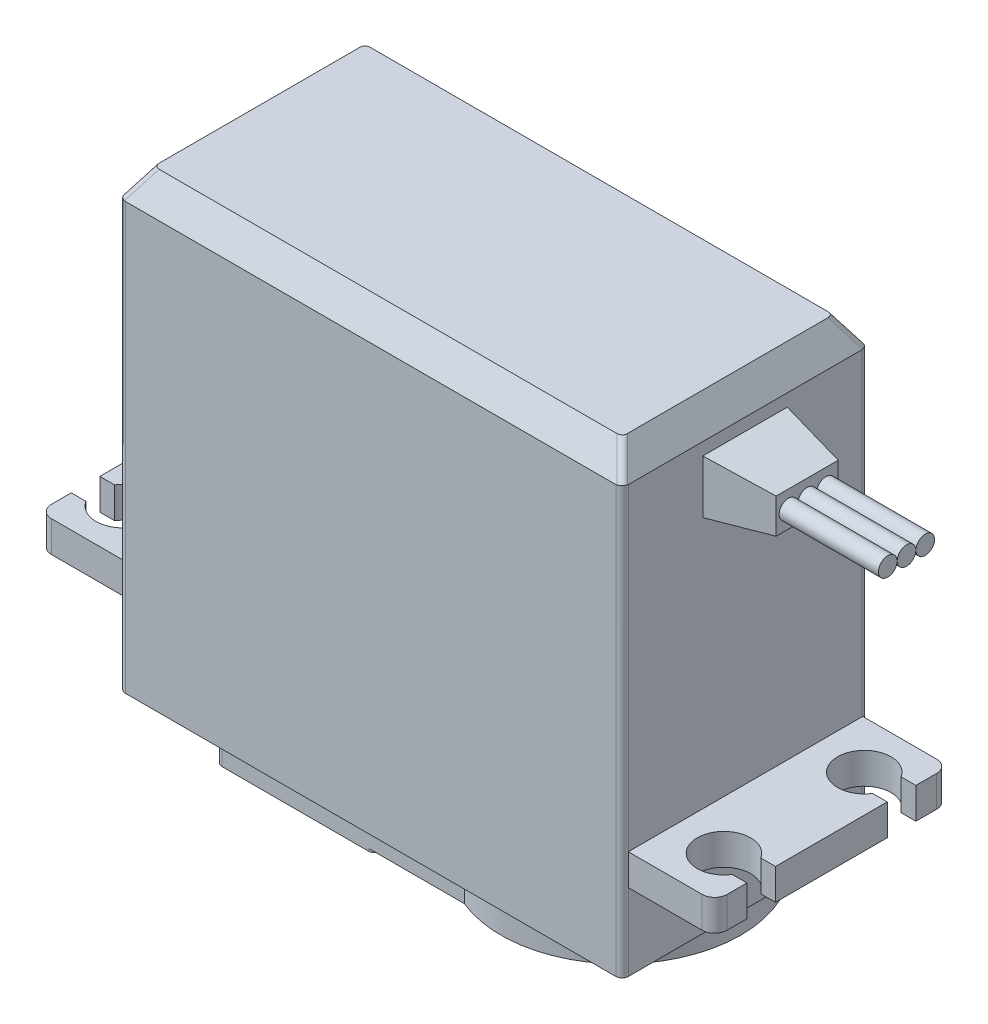
from build123d import *
from OCP.BRepFilletAPI import BRepFilletAPI_MakeChamfer

# Parameters (mm, degrees)
SKETCH_1_W       = 40.5
SKETCH_1_H       = 19.8
BODY_DEPTH       = 36.5
CHAMFER_1_SIZE   = 2.2
CHAMFER_1_SIZE2  = 1.4
FILLET_1_R       = 0.5
MOUNT_DEPTH      = 2.5
EXTRUDE_3_DEPTH  = 0.5
EXTRUDE_4_DEPTH  = 2
SKETCH_5_W       = 10.8
SKETCH_5_H       = 15.84
EXTRUDE_5_DEPTH  = 0.2
SKETCH_6_R       = 6.6
EXTRUDE_6_DEPTH  = 1.2
SKETCH_7_R       = 5.35
EXTRUDE_7_DEPTH  = 0.5
SKETCH_8_R       = 2.6
SHAFT_HOLE_DEPTH = 10
FILLET_2_R       = 0.5
SKETCH_11_R      = 0.75
EXTRUDE_10_DEPTH = 8


with BuildPart() as part:
    # Эскиз1 → Body (new body)
    with BuildSketch(Plane(origin=(0, 0, 0), x_dir=(1, 0, 0), z_dir=(0, 1, 0))):
        Rectangle(SKETCH_1_W, SKETCH_1_H)
    extrude(amount=BODY_DEPTH)

    # Фаска1: one chamfer whose edges measure the first distance from different faces: ONE call of the kernel's chamfer builder (chamfer() names one face for all edges)
    chamfer_1_edges_1 = [part.edges().sort_by_distance(p)[0] for p in [
        (20.25, 36.5, 0),
    ]]
    chamfer_1_side_1 = [part.faces().sort_by_distance(p)[0] for p in [
        (20.25, 18.25, 0),
    ]]
    chamfer_1_edges_2 = [part.edges().sort_by_distance(p)[0] for p in [
        (0, 36.5, -9.9),
    ]]
    chamfer_1_side_2 = [part.faces().sort_by_distance(p)[0] for p in [
        (0, 18.25, -9.9),
    ]]
    chamfer_1_edges_3 = [part.edges().sort_by_distance(p)[0] for p in [
        (-20.25, 36.5, 0),
    ]]
    chamfer_1_side_3 = [part.faces().sort_by_distance(p)[0] for p in [
        (-20.25, 18.25, 0),
    ]]
    chamfer_1_edges_4 = [part.edges().sort_by_distance(p)[0] for p in [
        (0, 36.5, 9.9),
    ]]
    chamfer_1_side_4 = [part.faces().sort_by_distance(p)[0] for p in [
        (0, 18.25, 9.9),
    ]]
    chamfer_1 = BRepFilletAPI_MakeChamfer(part.part.solid().wrapped)
    for e in chamfer_1_edges_1:
        chamfer_1.Add(CHAMFER_1_SIZE, CHAMFER_1_SIZE2, e.wrapped, chamfer_1_side_1[0].wrapped)  # the first distance lies on this face
    for e in chamfer_1_edges_2:
        chamfer_1.Add(CHAMFER_1_SIZE, CHAMFER_1_SIZE2, e.wrapped, chamfer_1_side_2[0].wrapped)  # the first distance lies on this face
    for e in chamfer_1_edges_3:
        chamfer_1.Add(CHAMFER_1_SIZE, CHAMFER_1_SIZE2, e.wrapped, chamfer_1_side_3[0].wrapped)  # the first distance lies on this face
    for e in chamfer_1_edges_4:
        chamfer_1.Add(CHAMFER_1_SIZE, CHAMFER_1_SIZE2, e.wrapped, chamfer_1_side_4[0].wrapped)  # the first distance lies on this face
    add(Compound.cast(chamfer_1.Shape()), mode=Mode.REPLACE)

    # Скругление1
    # the kernel refuses this fillet: 0.5 mm, written as the material it takes off along each edge
    with BuildSketch(Plane(origin=(-20.25, -1.25, 9.9), x_dir=(1, 0, 0), z_dir=(0, 1, 0)), Plane(origin=(-20.25, -1.25, -9.9), x_dir=(0, 0, 1), z_dir=(0, 1, 0))) as fillet_1_piece_1:
        with BuildLine():
            CenterArc((FILLET_1_R, FILLET_1_R), FILLET_1_R, 180, 90)
            Line((0, FILLET_1_R), (0, 0))
            Line((0, 0), (FILLET_1_R, 0))
        make_face()
    extrude(amount=36.8, mode=Mode.SUBTRACT)
    with BuildSketch(Plane(origin=(20.25, -1.25, -9.9), x_dir=(0, 0, 1), z_dir=(0, 1, 0)), Plane(origin=(20.25, -1.25, 9.9), x_dir=(-1, 0, 0), z_dir=(0, 1, 0))) as fillet_1_piece_2:
        with BuildLine():
            CenterArc((FILLET_1_R, -FILLET_1_R), FILLET_1_R, 90, 90)
            Line((0, -FILLET_1_R), (0, 0))
            Line((0, 0), (FILLET_1_R, 0))
        make_face()
    extrude(amount=36.8, mode=Mode.SUBTRACT)
    with BuildSketch(Plane(origin=(20.689497717, 33.609360731, -10.339497717), x_dir=(0.25395078633508533, -0.3990655213836877, 0.8810537485094523), z_dir=(-0.47301616487963943, 0.7433111162394352, 0.47301616487964004)), Plane(origin=(20.689497717, 33.609360731, 10.339497717), x_dir=(-0.8810537485094526, -0.39906552138369156, 0.25395078633507817), z_dir=(-0.47301616487963943, 0.7433111162394352, -0.47301616487964004))) as fillet_1_piece_3:
        with BuildLine():
            CenterArc((FILLET_1_R * 0.743311116239, -FILLET_1_R), FILLET_1_R, 90, 73.247664886)
            Line((-FILLET_1_R * 0.21424849821, -FILLET_1_R * 0.711764705882), (0, 0))
            Line((0, 0), (FILLET_1_R * 0.743311116239, 0))
        make_face()
    extrude(amount=4.818007508, mode=Mode.SUBTRACT)
    with BuildSketch(Plane(origin=(-20.689497717, 33.609360731, -10.339497717), x_dir=(-0.25395078633507856, -0.3990655213836921, 0.8810537485094524), z_dir=(0.47301616487963943, 0.7433111162394352, 0.47301616487964004)), Plane(origin=(-20.689497717, 33.609360731, 10.339497717), x_dir=(0.8810537485094527, -0.3990655213836916, 0.25395078633507817), z_dir=(0.47301616487963943, 0.7433111162394352, -0.47301616487964004))) as fillet_1_piece_4:
        with BuildLine():
            CenterArc((FILLET_1_R * 0.743311116239, FILLET_1_R), FILLET_1_R, 196.752335114, 73.247664886)
            Line((-FILLET_1_R * 0.21424849821, FILLET_1_R * 0.711764705882), (0, 0))
            Line((0, 0), (FILLET_1_R * 0.743311116239, 0))
        make_face()
    extrude(amount=4.818007508, mode=Mode.SUBTRACT)

    # Эскиз2 → Mount (add)
    with BuildSketch(Plane(origin=(0, 6.2, 0), x_dir=(-1, 0, 0), z_dir=(0, -1, 0))):
        with BuildLine():
            Line((-26.2, 9.472835762), (26.2, 9.472835762))
            ThreePointArc((26.2, 9.472835762), (26.907106781, 9.179942543), (27.2, 8.472835762))
            Line((27.2, 8.472835762), (27.2, 6.8))
            Line((27.2, 6.8), (26.016590212, 6.8))
            ThreePointArc((26.016590212, 6.8), (22.05, 5.65), (26.016590212, 4.5))
            Line((26.016590212, 4.5), (27.2, 4.5))
            Line((27.2, 4.5), (27.2, -4.5))
            Line((27.2, -4.5), (26.016590212, -4.5))
            ThreePointArc((26.016590212, -4.5), (22.05, -5.65), (26.016590212, -6.8))
            Line((26.016590212, -6.8), (27.2, -6.8))
            Line((27.2, -6.8), (27.2, -8.4))
            ThreePointArc((27.2, -8.4), (26.907106781, -9.107106781), (26.2, -9.4))
            Line((26.2, -9.4), (-26.2, -9.4))
            ThreePointArc((-26.2, -9.4), (-26.907106781, -9.107106781), (-27.2, -8.4))
            Line((-27.2, -8.4), (-27.2, -6.8))
            Line((-27.2, -6.8), (-26.016590212, -6.8))
            ThreePointArc((-26.016590212, -6.8), (-22.05, -5.65), (-26.016590212, -4.5))
            Line((-26.016590212, -4.5), (-27.2, -4.5))
            Line((-27.2, -4.5), (-27.2, 4.5))
            Line((-27.2, 4.5), (-26.016590212, 4.5))
            ThreePointArc((-26.016590212, 4.5), (-22.05, 5.65), (-26.016590212, 6.8))
            Line((-26.016590212, 6.8), (-27.2, 6.8))
            Line((-27.2, 6.8), (-27.2, 8.472835762))
            ThreePointArc((-27.2, 8.472835762), (-26.907106781, 9.179942543), (-26.2, 9.472835762))
        make_face()
    extrude(amount=-MOUNT_DEPTH)

    # Эскиз3 → Бобышка-Вытянуть3 (add, symmetric)
    with BuildSketch(Plane.XY):
        Polygon((-27.2, 6.2), (-20.25, 6.2), (-20.25, 5.2), align=None)
        Polygon((20.25, 5.2), (27.2, 6.2), (20.25, 6.2), align=None)
    extrude(amount=EXTRUDE_3_DEPTH, both=True)

    # Эскиз4 → Бобышка-Вытянуть4 (add)
    with BuildSketch(Plane.XZ):
        with BuildLine():
            Line((-13.452560024, -8.92), (-13.452560024, -4.6))
            ThreePointArc((-13.452560024, -4.6), (-16.49296823, 0), (-13.452560024, 4.6))
            Line((-13.452560024, 4.6), (-13.452560024, 8.92))
            Line((-13.452560024, 8.92), (6.568139057, 8.92))
            ThreePointArc((6.568139057, 8.92), (19.9, 0), (6.568139057, -8.92))
            Line((6.568139057, -8.92), (-13.452560024, -8.92))
        make_face()
    extrude(amount=EXTRUDE_4_DEPTH)

    # Эскиз5 → Бобышка-Вытянуть5 (add)
    with BuildSketch(Plane.XZ.offset(2)):
        with BuildLine():
            Line((-13.452560024, 8.92), (-0.652560024, 8.92))
            Line((-0.652560024, 8.92), (-0.652560024, 2))
            ThreePointArc((-0.652560024, 2), (1.347439976, 0), (-0.652560024, -2))
            Line((-0.652560024, -2), (-0.652560024, -8.92))
            Line((-0.652560024, -8.92), (-13.452560024, -8.92))
            Line((-13.452560024, -8.92), (-13.452560024, 8.92))
        make_face()
        with Locations((-7.052560024, 0)):
            Rectangle(SKETCH_5_W, SKETCH_5_H, mode=Mode.SUBTRACT)
    extrude(amount=EXTRUDE_5_DEPTH)

    # Эскиз6 → Бобышка-Вытянуть6 (add)
    with BuildSketch(Plane.XZ.offset(2)):
        with Locations(Location((10.25, 0, 0), (0, 0, 270))):
            Circle(SKETCH_6_R)
    extrude(amount=EXTRUDE_6_DEPTH)

    # Эскиз7 → Бобышка-Вытянуть7 (add)
    with BuildSketch(Plane.XZ.offset(3.2)):
        with Locations(Location((10.25, 0, 0), (0, 0, 270))):
            Circle(SKETCH_7_R)
    extrude(amount=EXTRUDE_7_DEPTH)

    # Эскиз8 → Shaft hole (cut)
    with BuildSketch(Plane.XZ.offset(3.7)):
        with Locations(Location((10.25, 0, 0), (0, 0, 270))):
            Circle(SKETCH_8_R)
    extrude(amount=-SHAFT_HOLE_DEPTH, mode=Mode.SUBTRACT)

    # Скругление2
    fillet_2_edges = [part.edges().sort_by_distance(p)[0] for p in [
        (-13.452560024, -1.1, 8.92),
        (-0.652560024, -2.1, 2),
        (-0.652560024, -2.1, -2),
        (-0.652560024, -2.1, 8.92),
        (-0.652560024, -2.1, -8.92),
        (-13.452560024, -1.1, -8.92),
        (-1.652560024, -2.1, 7.92),
        (-1.652560024, -2.1, -7.92),
        (-12.452560024, -2.1, 7.92),
        (-12.452560024, -2.1, -7.92),
    ]]
    fillet(fillet_2_edges, radius=FILLET_2_R)

    # Эскиз10 → Rubber section 0
    with BuildSketch(Plane(origin=(25.25, 0, 0), x_dir=(0, 0, -1), z_dir=(1, 0, 0))):
        with BuildLine():
            Line((-2.5, 29.75), (2.5, 29.75))
            Line((2.5, 29.75), (2.5, 32.55))
            Line((2.5, 32.55), (-2.5, 32.55))
            Line((-2.5, 32.55), (-2.5, 29.75))
        make_face()
    # Эскиз9 → Rubber section 1
    with BuildSketch(Plane(origin=(20.25, 0, 0), x_dir=(0, 0, -1), z_dir=(1, 0, 0))):
        with BuildLine():
            Line((-3.4, 33.3), (3.4, 33.3))
            Line((3.4, 33.3), (3.4, 29))
            Line((3.4, 29), (-3.4, 29))
            Line((-3.4, 29), (-3.4, 33.3))
        make_face()
    loft()

    # Эскиз11 → Бобышка-Вытянуть10 (add)
    with BuildSketch(Plane(origin=(25.25, 0, 0), x_dir=(0, 0, -1), z_dir=(1, 0, 0))):
        with Locations(Location((0, 31.150503064, 0), (0, 0, 180))):
            Circle(SKETCH_11_R)
        with Locations(Location((1.509999917, 31.15000331, 0), (0, 0, 180))):
            Circle(SKETCH_11_R)
        with Locations(Location((-1.509999915, 31.149996646, 0), (0, 0, 180))):
            Circle(SKETCH_11_R)
    extrude(amount=EXTRUDE_10_DEPTH)


solid = part.part
